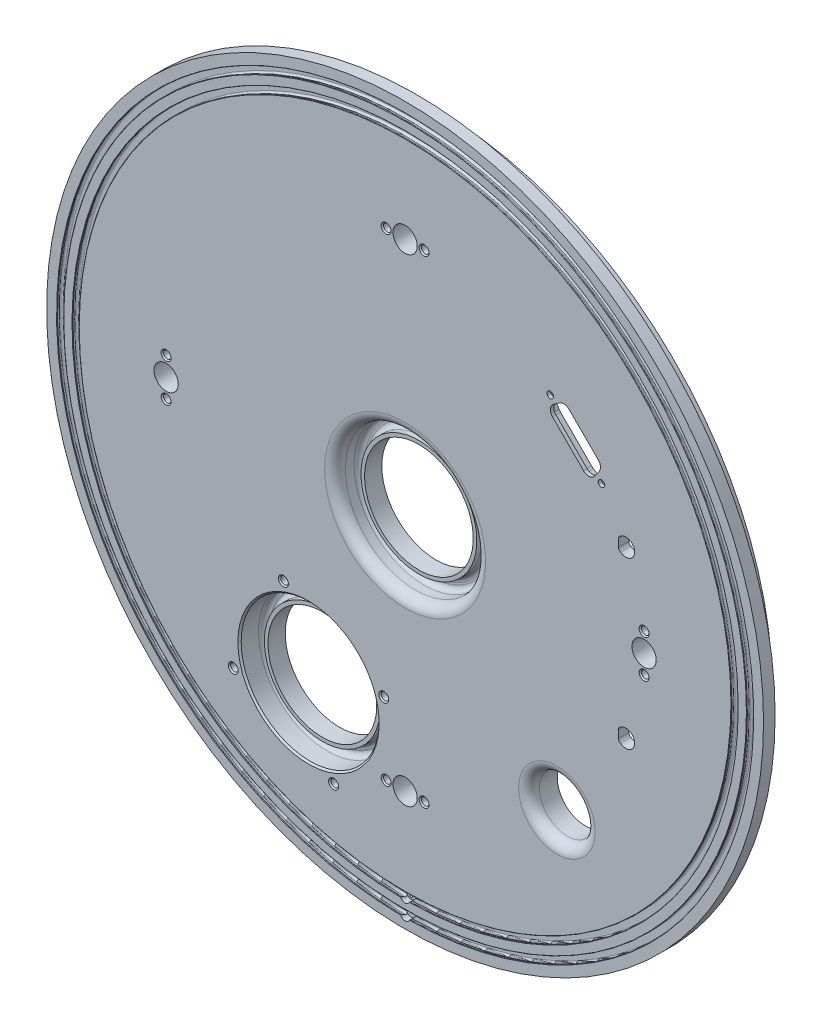
from build123d import *

# Parameters (mm, degrees)
BE_00_MATERIAL_BLANK_DEPTH         = 0.508
BE_00_MATERIAL_BLANK_DEPTH_BACK    = 15.875
SKETCH1_W                          = 330.2
SKETCH1_H                          = 330.2
SKETCH5_W                          = 76.2
SKETCH5_H                          = 307.1876
CUT_EXTRUDE6_REACH                 = 235.745
SKETCH51_R                         = 2.1844
CUT_EXTRUDE4_DEPTH                 = 9.525
CE_00_GROOVE_FOR_GASKET_DEPTH      = 2.286
SKETCH20_R                         = 5.588
CE_00_STANDOFF_POCKET_DEPTH        = 11.43
F_8_32_TAPPED_HOLE3_AT_2_COUNT     = 2
F_8_32_TAPPED_HOLE3_AT_2_PITCH     = 17.4752
CIRPATTERN5_COUNT                  = 4
CIRPATTERN6_COUNT                  = 4
F_8_32_TAPPED_HOLE5_D              = 3.4544
F_8_32_TAPPED_HOLE5_DEPTH          = 11.1252
F_8_32_TAPPED_HOLE5_CSINK_D        = 4.572
F_8_32_TAPPED_HOLE5_CSINK_ANGLE    = 90
F_8_32_TAPPED_HOLE5_TIP            = 1.037806461
CUT_EXTRUDE3_CONNECTOR_HOLES_REACH = 235.501
F_10_32_TAPPED_HOLE3_D             = 4.0386
F_10_32_TAPPED_HOLE3_DEPTH         = 12.0396
F_10_32_TAPPED_HOLE3_CSINK_D       = 5.08
F_10_32_TAPPED_HOLE3_CSINK_ANGLE   = 90
F_10_32_TAPPED_HOLE3_TIP           = 1.213317848
F_55_0_052_DIAMETER_HOLE1_D        = 1.3208
F_55_0_052_DIAMETER_HOLE1_DEPTH    = 7.9502
F_55_0_052_DIAMETER_HOLE1_TIP      = 0.396808353
SKETCH63_W                         = 6.35
SKETCH63_H                         = 34.751317012
F_41_0_096_DIAMETER_HOLE1_D        = 2.4384
F_41_0_096_DIAMETER_HOLE1_DEPTH    = 19.05
F_41_0_096_DIAMETER_HOLE1_TIP      = 0.732569267
F_10_32_TAPPED_HOLE4_D             = 4.0386
F_10_32_TAPPED_HOLE4_DEPTH         = 8.7376
F_10_32_TAPPED_HOLE4_CSINK_D       = 5.3086
F_10_32_TAPPED_HOLE4_CSINK_ANGLE   = 90
F_10_32_TAPPED_HOLE4_TIP           = 1.213317848
FILLET1_R                          = 2.3876
CIRPATTERN8_COUNT                  = 4
CHAMFER1_SIZE                      = 0.762
FILLET2_R                          = 1.6002
FILLET5_R                          = 4.7752
SKETCH52_R                         = 1.4986
CUT_EXTRUDE7_DEPTH                 = 234.501407171
CUT_EXTRUDE8_DEPTH                 = 3.175


with BuildPart() as part:
    # Sketch1 → BE-00 Material Blank (new, two sides: drawn at the far end of the back side and taken through both)
    with BuildSketch(Plane.XY.offset(-BE_00_MATERIAL_BLANK_DEPTH_BACK)):
        Rectangle(SKETCH1_W, SKETCH1_H)
    extrude(amount=BE_00_MATERIAL_BLANK_DEPTH + BE_00_MATERIAL_BLANK_DEPTH_BACK)

    # Sketch5 → CR-00 Profile Turn All (revolve, cut)
    with BuildSketch(Plane(origin=(0, 0, 0), x_dir=(0, 0, -1), z_dir=(1, 0, 0)), mode=Mode.PRIVATE) as cr_00_profile_turn_all_sk:
        with Locations((11.364913282, 153.5938)):
            Rectangle(SKETCH5_W, SKETCH5_H)
        with BuildLine():
            Line((0, 164.973), (0, 23.8125))
            Line((0, 23.8125), (14.3002, 23.8125))
            Line((14.3002, 23.8125), (14.3002, 154.7876))
            Line((14.3002, 154.7876), (8.9662, 154.7876))
            ThreePointArc((8.9662, 154.7876), (7.834687729, 155.256287729), (7.366, 156.3878))
            Line((7.366, 156.3878), (7.366, 157.389472759))
            Line((7.366, 157.389472759), (5.334, 164.973))
            Line((5.334, 164.973), (0, 164.973))
        make_face(mode=Mode.SUBTRACT)
    revolve(cr_00_profile_turn_all_sk.sketch.rotate(Axis((0, 0, -60.195390771), (0, 0, -1)), 90), axis=Axis((0, 0, -60.195390771), (0, 0, -1)), mode=Mode.SUBTRACT)

    # Sketch18 → CR-00 O-ring Grooves Radome (revolve, cut)
    with BuildSketch(Plane(origin=(0, 0, 0), x_dir=(0, 0, -1), z_dir=(1, 0, 0)), mode=Mode.PRIVATE) as cr_00_o_ring_grooves_radome_sk:
        with BuildLine():
            Line((-0.0254, 171.45), (-0.0254, 160.528))
            ThreePointArc((-0.0254, 160.528), (0.090261685, 160.314977676), (0.331911107, 160.295959454))
            Line((0.331911107, 160.295959454), (1.737135567, 160.921605693))
            ThreePointArc((1.737135567, 160.921605693), (2.486248776, 160.862649204), (2.8448, 160.202279999))
            Line((2.8448, 160.202279999), (2.8448, 157.297720001))
            ThreePointArc((2.8448, 157.297720001), (2.486248776, 156.637350796), (1.737135567, 156.578394307))
            Line((1.737135567, 156.578394307), (0.331911107, 157.204040546))
            ThreePointArc((0.331911107, 157.204040546), (0.090261685, 157.185022324), (-0.0254, 156.972))
            Line((-0.0254, 156.972), (-0.0254, 153.416))
            ThreePointArc((-0.0254, 153.416), (0.090261685, 153.202977676), (0.331911107, 153.183959454))
            Line((0.331911107, 153.183959454), (1.737135567, 153.809605693))
            ThreePointArc((1.737135567, 153.809605693), (2.486248776, 153.750649204), (2.8448, 153.090279999))
            Line((2.8448, 153.090279999), (2.8448, 150.185720001))
            ThreePointArc((2.8448, 150.185720001), (2.486248776, 149.525350796), (1.737135567, 149.466394307))
            Line((1.737135567, 149.466394307), (0.331911107, 150.092040546))
            ThreePointArc((0.331911107, 150.092040546), (0.090261685, 150.073022324), (-0.0254, 149.86))
            Line((-0.0254, 149.86), (-0.0254, 138.938))
            Line((-0.0254, 138.938), (-19.014781745, 119.948618255))
            Line((-19.014781745, 119.948618255), (-19.014781745, 171.45))
            Line((-19.014781745, 171.45), (-0.0254, 171.45))
        make_face()
    revolve(cr_00_o_ring_grooves_radome_sk.sketch.rotate(Axis((0, 0, 87.110448783), (0, 0, -1)), 90), axis=Axis((0, 0, 87.110448783), (0, 0, -1)), mode=Mode.SUBTRACT)

    # Cut-Extrude6: up to this face of the body (flat: up to its plane)
    cut_extrude6_end = Plane(part.part.faces().sort_by_distance((-152.657275299, 0, -2.8448))[0])
    # Sketch51 → Cut-Extrude6 (cut, up to the picked face)
    with BuildSketch(Plane.XY, mode=Mode.PRIVATE) as cut_extrude6_sk1:
        with Locations((0, -152.4)):
            Circle(SKETCH51_R)
    cut_extrude6_tool1 = split(extrude(cut_extrude6_sk1.sketch, amount=-CUT_EXTRUDE6_REACH, mode=Mode.PRIVATE), bisect_by=cut_extrude6_end, keep=Keep.BOTH, mode=Mode.PRIVATE)
    # Sketch51 → Cut-Extrude6 (cut, up to the picked face)
    with BuildSketch(Plane.XY, mode=Mode.PRIVATE) as cut_extrude6_sk2:
        with Locations((0, -159.512)):
            Circle(SKETCH51_R)
    cut_extrude6_tool2 = split(extrude(cut_extrude6_sk2.sketch, amount=-CUT_EXTRUDE6_REACH, mode=Mode.PRIVATE), bisect_by=cut_extrude6_end, keep=Keep.BOTH, mode=Mode.PRIVATE)
    add(cut_extrude6_tool1.solids().sort_by(Axis((0, -152.4, 0), (0, 0, -1)))[0], mode=Mode.SUBTRACT)
    add(cut_extrude6_tool2.solids().sort_by(Axis((0, -159.512, 0), (0, 0, -1)))[0], mode=Mode.SUBTRACT)

    # Sketch29 → Cut-Extrude4 (cut)
    with BuildSketch(Plane(origin=(0, 0, -14.3002), x_dir=(-1, 0, 0), z_dir=(0, 0, -1))):
        with BuildLine():
            Line((13.748153285, 109.5375), (16.039284443, 113.505855572))
            ThreePointArc((16.039284443, 113.505855572), (29.495327916, 118.403454867), (36.655139101, 106.002298122))
            Line((36.655139101, 106.002298122), (26.185554718, 46.626334551))
            ThreePointArc((26.185554718, 46.626334551), (22.638268275, 41.645855636), (16.535863775, 41.259758957))
            ThreePointArc((16.535863775, 41.259758957), (0, 44.45), (-16.535863775, 41.259758957))
            ThreePointArc((-16.535863775, 41.259758957), (-22.638268275, 41.645855636), (-26.185554718, 46.626334551))
            Line((-26.185554718, 46.626334551), (-36.655139101, 106.002298122))
            ThreePointArc((-36.655139101, 106.002298122), (-29.495327916, 118.403454867), (-16.039284443, 113.505855572))
            Line((-16.039284443, 113.505855572), (-13.748153285, 109.5375))
            ThreePointArc((-13.748153285, 109.5375), (0, 101.6), (13.748153285, 109.5375))
        make_face()
        with BuildLine():
            Line((-122.2502, -22.225), (-122.2502, -50.626559318))
            ThreePointArc((-122.2502, -50.626559318), (-120.855409426, -54.856696476), (-117.218124528, -57.42762232))
            ThreePointArc((-117.218124528, -57.42762232), (-112.953452637, -61.812780623), (-114.369422175, -67.763584766))
            ThreePointArc((-114.369422175, -67.763584766), (-116.191126438, -72.008147551), (-115.021344629, -76.476539898))
            ThreePointArc((-115.021344629, -76.476539898), (-112.289204697, -80.434478823), (-109.420931162, -84.29490316))
            ThreePointArc((-109.420931162, -84.29490316), (-101.752921651, -86.769544222), (-96.695607569, -80.496921763))
            ThreePointArc((-96.695607569, -80.496921763), (-88.128655597, -62.781526979), (-69.797615218, -55.626050961))
            ThreePointArc((-69.797615218, -55.626050961), (-66.50596015, -54.825677206), (-63.95796839, -52.593340038))
            Line((-63.95796839, -52.593340038), (-41.637407585, -20.716275615))
            ThreePointArc((-41.637407585, -20.716275615), (-41.154795878, -13.353043863), (-47.463216924, -9.525))
            Line((-47.463216924, -9.525), (-99.78529618, -9.525))
            ThreePointArc((-99.78529618, -9.525), (-101.02028202, -9.633047261), (-102.217743439, -9.953906081))
            Line((-102.217743439, -9.953906081), (-117.570647259, -15.541906081))
            ThreePointArc((-117.570647259, -15.541906081), (-120.964009339, -18.145724385), (-122.2502, -22.225))
        make_face()
        with BuildLine():
            Line((-11.487435309, -104.057554296), (10.636701717, -68.096953606))
            ThreePointArc((10.636701717, -68.096953606), (18.61883726, -58.752746202), (29.076216994, -52.297367907))
            ThreePointArc((29.076216994, -52.297367907), (33.002032679, -41.747934438), (22.226379645, -38.494032627))
            ThreePointArc((22.226379645, -38.494032627), (-0.240063406, -44.449351734), (-22.64087039, -38.251712223))
            ThreePointArc((-22.64087039, -38.251712223), (-27.765081492, -37.420329852), (-32.089218991, -40.292710564))
            Line((-32.089218991, -40.292710564), (-46.522506687, -60.905581617))
            ThreePointArc((-46.522506687, -60.905581617), (-47.80451385, -64.74095445), (-46.78843223, -68.655185572))
            ThreePointArc((-46.78843223, -68.655185572), (-43.333019149, -87.213850616), (-52.913434869, -103.479752449))
            ThreePointArc((-52.913434869, -103.479752449), (-55.539784163, -108.598138475), (-53.520396113, -113.98494254))
            ThreePointArc((-53.520396113, -113.98494254), (-51.235426875, -117.803021705), (-50.934051114, -122.242389405))
            ThreePointArc((-50.934051114, -122.242389405), (-50.05670486, -127.029663369), (-46.306438838, -130.131797026))
            ThreePointArc((-46.306438838, -130.131797026), (-31.259715574, -134.541447358), (-15.81017563, -137.217379444))
            ThreePointArc((-15.81017563, -137.217379444), (-9.413735188, -134.558658051), (-8.313023385, -127.719675428))
            Line((-8.313023385, -127.719675428), (-12.674010254, -115.737962481))
            ThreePointArc((-12.674010254, -115.737962481), (-13.418339941, -109.761874181), (-11.487435309, -104.057554296))
        make_face()
        with BuildLine():
            Line((102.217743439, 9.953906081), (117.570647259, 15.541906081))
            ThreePointArc((117.570647259, 15.541906081), (120.964009339, 18.145724385), (122.2502, 22.225))
            Line((122.2502, 22.225), (122.2502, 49.2252))
            ThreePointArc((122.2502, 49.2252), (121.766835031, 51.655239796), (120.390328061, 53.715328061))
            Line((120.390328061, 53.715328061), (67.473921735, 106.631734386))
            ThreePointArc((67.473921735, 106.631734386), (60.306358661, 108.385625912), (55.441025567, 102.837776798))
            Line((55.441025567, 102.837776798), (40.459264184, 17.87198584))
            ThreePointArc((40.459264184, 17.87198584), (42.015108844, 12.06549452), (47.463216924, 9.525))
            Line((47.463216924, 9.525), (99.78529618, 9.525))
            ThreePointArc((99.78529618, 9.525), (101.02028202, 9.633047261), (102.217743439, 9.953906081))
        make_face()
        with BuildLine():
            Line((122.2502, -22.225), (122.2502, -62.511226792))
            ThreePointArc((122.2502, -62.511226792), (122.031392043, -64.26178312), (121.388431873, -65.904624136))
            ThreePointArc((121.388431873, -65.904624136), (114.325846816, -77.512396589), (106.156947565, -88.370093123))
            ThreePointArc((106.156947565, -88.370093123), (97.143099774, -92.36792449), (88.493378325, -87.633536832))
            Line((88.493378325, -87.633536832), (41.637407585, -20.716275615))
            ThreePointArc((41.637407585, -20.716275615), (41.154795878, -13.353043863), (47.463216924, -9.525))
            Line((47.463216924, -9.525), (99.78529618, -9.525))
            ThreePointArc((99.78529618, -9.525), (101.02028202, -9.633047261), (102.217743439, -9.953906081))
            Line((102.217743439, -9.953906081), (117.570647259, -15.541906081))
            ThreePointArc((117.570647259, -15.541906081), (120.964009339, -18.145724385), (122.2502, -22.225))
        make_face()
        with BuildLine():
            Line((-120.390328061, 53.715328061), (-67.473921735, 106.631734386))
            ThreePointArc((-67.473921735, 106.631734386), (-60.306358661, 108.385625912), (-55.441025567, 102.837776798))
            Line((-55.441025567, 102.837776798), (-40.459264184, 17.87198584))
            ThreePointArc((-40.459264184, 17.87198584), (-42.015108844, 12.06549452), (-47.463216924, 9.525))
            Line((-47.463216924, 9.525), (-99.78529618, 9.525))
            ThreePointArc((-99.78529618, 9.525), (-101.02028202, 9.633047261), (-102.217743439, 9.953906081))
            Line((-102.217743439, 9.953906081), (-117.570647259, 15.541906081))
            ThreePointArc((-117.570647259, 15.541906081), (-120.964009339, 18.145724385), (-122.2502, 22.225))
            Line((-122.2502, 22.225), (-122.2502, 49.2252))
            ThreePointArc((-122.2502, 49.2252), (-121.766835031, 51.655239796), (-120.390328061, 53.715328061))
        make_face()
    extrude(amount=-CUT_EXTRUDE4_DEPTH, mode=Mode.SUBTRACT)

    # Sketch34 → CE-00 Groove for Gasket (cut)
    with BuildSketch(Plane(origin=(0, 0, -14.3002), x_dir=(-1, 0, 0), z_dir=(0, 0, -1))):
        with BuildLine():
            Line((-55.064487758, 131.7752), (55.064487758, 131.7752))
            ThreePointArc((55.064487758, 131.7752), (59.924567349, 130.808470063), (64.044743879, 128.055456121))
            Line((64.044743879, 128.055456121), (131.230456121, 60.869743879))
            ThreePointArc((131.230456121, 60.869743879), (133.983470063, 56.749567349), (134.9502, 51.889487758))
            Line((134.9502, 51.889487758), (134.9502, -64.291986087))
            ThreePointArc((134.9502, -64.291986087), (134.579892294, -67.33643808), (133.490564104, -70.20334928))
            ThreePointArc((133.490564104, -70.20334928), (0, -150.8252), (-133.490564104, -70.20334928))
            ThreePointArc((-133.490564104, -70.20334928), (-134.579892294, -67.33643808), (-134.9502, -64.291986087))
            Line((-134.9502, -64.291986087), (-134.9502, 51.889487758))
            ThreePointArc((-134.9502, 51.889487758), (-133.983470063, 56.749567349), (-131.230456121, 60.869743879))
            Line((-131.230456121, 60.869743879), (-64.044743879, 128.055456121))
            ThreePointArc((-64.044743879, 128.055456121), (-59.924567349, 130.808470063), (-55.064487758, 131.7752))
        make_face()
        with BuildLine():
            Line((-55.064487758, 124.6632), (55.064487758, 124.6632))
            ThreePointArc((55.064487758, 124.6632), (57.202922778, 124.237838828), (59.015800451, 123.026512693))
            Line((59.015800451, 123.026512693), (126.201512693, 55.840800451))
            ThreePointArc((126.201512693, 55.840800451), (127.412838828, 54.027922778), (127.8382, 51.889487758))
            Line((127.8382, 51.889487758), (127.8382, -64.291986087))
            ThreePointArc((127.8382, -64.291986087), (127.675264609, -65.631544964), (127.195960206, -66.892985892))
            ThreePointArc((127.195960206, -66.892985892), (0, -143.7132), (-127.195960206, -66.892985892))
            ThreePointArc((-127.195960206, -66.892985892), (-127.675264609, -65.631544964), (-127.8382, -64.291986087))
            Line((-127.8382, -64.291986087), (-127.8382, 51.889487758))
            ThreePointArc((-127.8382, 51.889487758), (-127.412838828, 54.027922778), (-126.201512693, 55.840800451))
            Line((-126.201512693, 55.840800451), (-59.015800451, 123.026512693))
            ThreePointArc((-59.015800451, 123.026512693), (-57.202922778, 124.237838828), (-55.064487758, 124.6632))
        make_face(mode=Mode.SUBTRACT)
    extrude(amount=-CE_00_GROOVE_FOR_GASKET_DEPTH, mode=Mode.SUBTRACT)

    # Sketch23 → CR-00 Hole for Cooler (revolve, cut)
    with BuildSketch(Plane(origin=(0, 0, 0), x_dir=(0, 0, -1), z_dir=(1, 0, 0)), mode=Mode.PRIVATE) as cr_00_hole_for_cooler_sk:
        Polygon((44.68963757, 25.019), (6.35, 25.019), (6.35, 26.67), (11.1252, 26.67), (11.1252, 32.258), (-9.342963899, 32.258), (-9.342963899, 0), (44.68963757, 0), align=None)
    revolve(cr_00_hole_for_cooler_sk.sketch.rotate(Axis((0, 0, -44.68963757), (0, 0, 1)), 90), axis=Axis((0, 0, -44.68963757), (0, 0, 1)), mode=Mode.SUBTRACT)

    # Sketch20 → CE-00 Standoff Pocket (cut)
    with BuildSketch(Plane(origin=(0, 0, 0), x_dir=(-1, 0, 0), z_dir=(0, 0, -1))):
        with Locations((-109.982, 0)):
            Circle(SKETCH20_R)
    ce_00_standoff_pocket = extrude(amount=CE_00_STANDOFF_POCKET_DEPTH, mode=Mode.SUBTRACT)

    # Sketch21 → #8-32 Tapped Hole3 (revolve, cut)
    with BuildSketch(Plane(origin=(109.982, 8.7376, 0), x_dir=(0, -1, 0), z_dir=(1, 0, 0))):
        Polygon((0, 0), (0, 12.163006461), (1.7272, 11.1252), (1.7272, 0.5588), (2.286, 0), align=None)
    f_8_32_tapped_hole3 = revolve(axis=Axis((109.982, 8.7376, 6.35), (0, 0, -1)), mode=Mode.SUBTRACT)

    # #8-32 Tapped Hole3 at 2: #8-32 Tapped Hole3 ×2
    with Locations(*[(0, -i * F_8_32_TAPPED_HOLE3_AT_2_PITCH, 0) for i in range(1, F_8_32_TAPPED_HOLE3_AT_2_COUNT)]):
        add(f_8_32_tapped_hole3, mode=Mode.SUBTRACT)

    # CirPattern5: CE-00 Standoff Pocket ×4 about axis
    cirpattern5_axis = Axis((0, 0, 0), (0, 0, 1))
    for i in range(1, CIRPATTERN5_COUNT):
        add(ce_00_standoff_pocket.rotate(cirpattern5_axis, i * 360 / CIRPATTERN5_COUNT), mode=Mode.SUBTRACT)

    # CirPattern6: #8-32 Tapped Hole3 ×4 about axis
    cirpattern6_axis = Axis((0, 0, 0), (0, 0, 1))
    for i in range(1, CIRPATTERN6_COUNT):
        add(f_8_32_tapped_hole3.rotate(cirpattern6_axis, i * 360 / CIRPATTERN6_COUNT), mode=Mode.SUBTRACT)

    # CirPattern6 copy 1 sketch → CirPattern6 copy 1 (revolve, cut)
    with BuildSketch(Plane(origin=(8.7376, 109.982, 0), x_dir=(1, 0, 0), z_dir=(0, 1, 0))):
        Polygon((0, 0), (0, 12.163006461), (1.7272, 11.1252), (1.7272, 0.5588), (2.286, 0), align=None)
    revolve(axis=Axis((8.7376, 109.982, 6.35), (0, 0, -1)), mode=Mode.SUBTRACT)

    # CirPattern6 copy 2 sketch → CirPattern6 copy 2 (revolve, cut)
    with BuildSketch(Plane(origin=(-109.982, 8.7376, 0), x_dir=(0, 1, 0), z_dir=(-1, 0, 0))):
        Polygon((0, 0), (0, 12.163006461), (1.7272, 11.1252), (1.7272, 0.5588), (2.286, 0), align=None)
    revolve(axis=Axis((-109.982, 8.7376, 6.35), (0, 0, -1)), mode=Mode.SUBTRACT)

    # CirPattern6 copy 3 sketch → CirPattern6 copy 3 (revolve, cut)
    with BuildSketch(Plane(origin=(-8.7376, -109.982, 0), x_dir=(-1, 0, 0), z_dir=(0, -1, 0))):
        Polygon((0, 0), (0, 12.163006461), (1.7272, 11.1252), (1.7272, 0.5588), (2.286, 0), align=None)
    revolve(axis=Axis((-8.7376, -109.982, 6.35), (0, 0, -1)), mode=Mode.SUBTRACT)

    # Sketch24 → CR-00 Hole for Turbo (revolve, cut)
    with BuildSketch(Plane(origin=(-44.45, 0, 0), x_dir=(0, 0, -1), z_dir=(1, 0, 0)), mode=Mode.PRIVATE) as cr_00_hole_for_turbo_sk:
        Polygon((30.004152795, -63.881), (6.35, -63.881), (6.35, -62.23), (11.1252, -62.23), (11.1252, -57.15), (-16.015173557, -57.15), (-16.015173557, -88.9), (30.004152795, -88.9), align=None)
    revolve(cr_00_hole_for_turbo_sk.sketch.rotate(Axis((-44.45, -88.9, -30.004152795), (0, 0, -1)), 90), axis=Axis((-44.45, -88.9, -30.004152795), (0, 0, -1)), mode=Mode.SUBTRACT)

    # #8-32 Tapped Hole5
    with Locations(Plane.XY):
        with Locations((-9.81120108, -77.353733693), (-55.996266307, -54.26120108), (-79.08879892, -100.446266307), (-32.903733693, -123.53879892)):
            CounterSinkHole(F_8_32_TAPPED_HOLE5_D / 2, F_8_32_TAPPED_HOLE5_CSINK_D / 2, depth=F_8_32_TAPPED_HOLE5_DEPTH, counter_sink_angle=F_8_32_TAPPED_HOLE5_CSINK_ANGLE)
            with Locations((0, 0, -(F_8_32_TAPPED_HOLE5_DEPTH + F_8_32_TAPPED_HOLE5_TIP / 2))):  # 118° drill point
                Cone(0, F_8_32_TAPPED_HOLE5_D / 2, F_8_32_TAPPED_HOLE5_TIP, mode=Mode.SUBTRACT)

    # Sketch28 → Cut-Extrude3 Connector Holes (cut, up to next)
    with BuildSketch(Plane(origin=(0, 0, -4.7752), x_dir=(-1, 0, 0), z_dir=(0, 0, -1)), mode=Mode.PRIVATE) as cut_extrude3_connector_holes_sk1:
        with BuildLine():
            Line((-99.195939526, 34.854883177), (-98.68500614, 35.233394899))
            ThreePointArc((-98.68500614, 35.233394899), (-98.306757477, 35.682562953), (-98.171, 36.253871887))
            Line((-98.171, 36.253871887), (-98.171, 39.946128113))
            ThreePointArc((-98.171, 39.946128113), (-98.306757477, 40.517437047), (-98.68500614, 40.966605101))
            Line((-98.68500614, 40.966605101), (-99.195939526, 41.345116823))
            ThreePointArc((-99.195939526, 41.345116823), (-105.6386, 38.1), (-99.195939526, 34.854883177))
        make_face()
    cut_extrude3_connector_holes_tool1 = extrude(cut_extrude3_connector_holes_sk1.sketch, amount=-CUT_EXTRUDE3_CONNECTOR_HOLES_REACH, mode=Mode.PRIVATE) & part.part
    # Sketch28 → Cut-Extrude3 Connector Holes (cut, up to next)
    with BuildSketch(Plane(origin=(0, 0, -4.7752), x_dir=(-1, 0, 0), z_dir=(0, 0, -1)), mode=Mode.PRIVATE) as cut_extrude3_connector_holes_sk2:
        with BuildLine():
            Line((-98.171, -39.946128113), (-98.171, -36.253871887))
            ThreePointArc((-98.171, -36.253871887), (-98.306757477, -35.682562953), (-98.68500614, -35.233394899))
            Line((-98.68500614, -35.233394899), (-99.195939526, -34.854883177))
            ThreePointArc((-99.195939526, -34.854883177), (-105.6386, -38.1), (-99.195939526, -41.345116823))
            Line((-99.195939526, -41.345116823), (-98.68500614, -40.966605101))
            ThreePointArc((-98.68500614, -40.966605101), (-98.306757477, -40.517437047), (-98.171, -39.946128113))
        make_face()
    cut_extrude3_connector_holes_tool2 = extrude(cut_extrude3_connector_holes_sk2.sketch, amount=-CUT_EXTRUDE3_CONNECTOR_HOLES_REACH, mode=Mode.PRIVATE) & part.part
    add(cut_extrude3_connector_holes_tool1.solids().sort_by_distance((101.724691, 38.1, -4.7752))[0], mode=Mode.SUBTRACT)
    add(cut_extrude3_connector_holes_tool2.solids().sort_by_distance((101.724691, -38.1, -4.7752))[0], mode=Mode.SUBTRACT)

    # #10-32 Tapped Hole3
    with Locations(Plane(origin=(0, 0, -14.3002), x_dir=(-1, 0, 0), z_dir=(0, 0, -1))):
        with Locations((92.075, -98.425), (50.8, 115.9002), (-50.8, 115.9002), (-60.325, -120.65), (119.0752, 11.1252), (-119.0752, 11.1252), (-119.0752, -63.5), (19.05, -134.9502)):
            CounterSinkHole(F_10_32_TAPPED_HOLE3_D / 2, F_10_32_TAPPED_HOLE3_CSINK_D / 2, depth=F_10_32_TAPPED_HOLE3_DEPTH, counter_sink_angle=F_10_32_TAPPED_HOLE3_CSINK_ANGLE)
            with Locations((0, 0, -(F_10_32_TAPPED_HOLE3_DEPTH + F_10_32_TAPPED_HOLE3_TIP / 2))):  # 118° drill point
                Cone(0, F_10_32_TAPPED_HOLE3_D / 2, F_10_32_TAPPED_HOLE3_TIP, mode=Mode.SUBTRACT)

    # #55 (0.052) Diameter Hole1
    with Locations(Plane.XY):
        with Locations((0, -153.162)):
            Hole(F_55_0_052_DIAMETER_HOLE1_D / 2, depth=F_55_0_052_DIAMETER_HOLE1_DEPTH)
            with Locations((0, 0, -(F_55_0_052_DIAMETER_HOLE1_DEPTH + F_55_0_052_DIAMETER_HOLE1_TIP / 2))):  # 118° drill point
                Cone(0, F_55_0_052_DIAMETER_HOLE1_D / 2, F_55_0_052_DIAMETER_HOLE1_TIP, mode=Mode.SUBTRACT)

    # Sketch63 → Cut-Revolve2 (revolve, cut)
    with BuildSketch(Plane(origin=(0, 0, 0), x_dir=(0, 0, -1), z_dir=(1, 0, 0))):
        with Locations((9.271, -172.112458506)):
            Rectangle(SKETCH63_W, SKETCH63_H)
    revolve(axis=Axis((0, -189.488117012, -12.446), (0, -1, 0)), mode=Mode.SUBTRACT)

    # #41 (0.096) Diameter Hole1
    with Locations(Plane.XZ.offset(154.7368)):
        with Locations((0, -8.89)):
            Hole(F_41_0_096_DIAMETER_HOLE1_D / 2, depth=F_41_0_096_DIAMETER_HOLE1_DEPTH)
            with Locations((0, 0, -(F_41_0_096_DIAMETER_HOLE1_DEPTH + F_41_0_096_DIAMETER_HOLE1_TIP / 2))):  # 118° drill point
                Cone(0, F_41_0_096_DIAMETER_HOLE1_D / 2, F_41_0_096_DIAMETER_HOLE1_TIP, mode=Mode.SUBTRACT)

    # #10-32 Tapped Hole4
    with Locations(Plane(origin=(0, 0, -14.3002), x_dir=(-1, 0, 0), z_dir=(0, 0, -1))):
        with Locations((0, -134.9502)):
            CounterSinkHole(F_10_32_TAPPED_HOLE4_D / 2, F_10_32_TAPPED_HOLE4_CSINK_D / 2, depth=F_10_32_TAPPED_HOLE4_DEPTH, counter_sink_angle=F_10_32_TAPPED_HOLE4_CSINK_ANGLE)
            with Locations((0, 0, -(F_10_32_TAPPED_HOLE4_DEPTH + F_10_32_TAPPED_HOLE4_TIP / 2))):  # 118° drill point
                Cone(0, F_10_32_TAPPED_HOLE4_D / 2, F_10_32_TAPPED_HOLE4_TIP, mode=Mode.SUBTRACT)

    # Sketch46 → Cut-Revolve1 (revolve, cut)
    with BuildSketch(Plane(origin=(69.85, 0, 0), x_dir=(0, 0, -1), z_dir=(1, 0, 0)), mode=Mode.PRIVATE) as cut_revolve1_sk:
        Polygon((-25.4, -82.55), (25.4, -82.55), (25.4, -66.04), (12.740715605, -66.04), (13.6652, -68.58), (13.0302, -68.58), (13.0302, -69.723), (-6.35, -69.723), (-6.35, -68.072), (-3.175, -68.072), (-3.175, -62.992), (-25.4, -62.992), align=None)
    revolve(cut_revolve1_sk.sketch.rotate(Axis((69.85, -82.55, -25.4), (0, 0, -1)), 90), axis=Axis((69.85, -82.55, -25.4), (0, 0, -1)), mode=Mode.SUBTRACT)

    # Fillet1
    fillet1_edges = [part.edges().sort_by_distance(p)[0] for p in [
        (26.67, 0, -11.1252),
        (32.258, 0, -11.1252),
        (-76.2, -88.9, -11.1252),
        (-71.12, -88.9, -11.1252),
    ]]
    fillet(fillet1_edges, radius=FILLET1_R)

    # Sketch48 → 1/4-28 Tapped Hole1 (revolve, cut)
    with BuildSketch(Plane(origin=(55.257083803, -67.957083803, -14.3002), x_dir=(0, 1, 0), z_dir=(1, 0, 0))):
        Polygon((0, 0), (0, 12.750588061), (2.7051, 11.1252), (2.7051, 0.6731), (3.3782, 0), align=None)
    f_1_4_28_tapped_hole1 = revolve(axis=Axis((55.257083803, -67.957083803, -20.6502), (0, 0, 1)), mode=Mode.SUBTRACT)

    # CirPattern8: 1/4-28 Tapped Hole1 ×4 about axis
    cirpattern8_axis = Axis((69.85, -82.55, 0), (0, 0, 1))
    for i in range(1, CIRPATTERN8_COUNT):
        add(f_1_4_28_tapped_hole1.rotate(cirpattern8_axis, i * 360 / CIRPATTERN8_COUNT), mode=Mode.SUBTRACT)

    # Chamfer1
    chamfer1_edges = [part.edges().sort_by_distance(p)[0] for p in [
        (-76.2, -88.9, 0),
    ]]
    chamfer(chamfer1_edges, length=CHAMFER1_SIZE)

    # Fillet2
    fillet2_edges = [part.edges().sort_by_distance(p)[0] for p in [
        (112.953452637, -61.812780623, -4.7752),
        (120.855409426, -54.856696476, -4.7752),
        (122.2502, -36.425779659, -4.7752),
        (120.964009339, -18.145724385, -4.7752),
        (109.894195349, -12.747906081, -4.7752),
        (101.02028202, -9.633047261, -4.7752),
        (73.624256552, -9.525, -4.7752),
        (41.154795878, -13.353043863, -4.7752),
        (52.797687987, -36.654807827, -4.7752),
        (66.50596015, -54.825677206, -4.7752),
        (88.128655597, -62.781526979, -4.7752),
        (101.752921651, -86.769544222, -4.7752),
        (112.289204697, -80.434478823, -4.7752),
        (116.191126438, -72.008147551, -4.7752),
        (-120.964009339, 18.145724385, -4.7752),
        (-109.894195349, 12.747906081, -4.7752),
        (-101.02028202, 9.633047261, -4.7752),
        (-73.624256552, 9.525, -4.7752),
        (-42.015108844, 12.06549452, -4.7752),
        (-47.950144876, 60.354881319, -4.7752),
        (-60.306358661, 108.385625912, -4.7752),
        (-93.932124898, 80.173531223, -4.7752),
        (-121.766835031, 51.655239796, -4.7752),
        (-122.2502, 35.7251, -4.7752),
        (121.766835031, 51.655239796, -4.7752),
        (93.932124898, 80.173531223, -4.7752),
        (60.306358661, 108.385625912, -4.7752),
        (47.950144876, 60.354881319, -4.7752),
        (42.015108844, 12.06549452, -4.7752),
        (73.624256552, 9.525, -4.7752),
        (101.02028202, 9.633047261, -4.7752),
        (109.894195349, 12.747906081, -4.7752),
        (120.964009339, 18.145724385, -4.7752),
        (122.2502, 35.7251, -4.7752),
        (-120.964009339, -18.145724385, -4.7752),
        (-122.2502, -42.368113396, -4.7752),
        (-122.031392043, -64.26178312, -4.7752),
        (-114.325846816, -77.512396589, -4.7752),
        (-97.143099774, -92.36792449, -4.7752),
        (-65.065392955, -54.174906224, -4.7752),
        (-41.154795878, -13.353043863, -4.7752),
        (-73.624256552, -9.525, -4.7752),
        (-101.02028202, -9.633047261, -4.7752),
        (-109.894195349, -12.747906081, -4.7752),
        (22.638268275, 41.645855636, -4.7752),
        (31.42034691, 76.314316336, -4.7752),
        (29.495327916, 118.403454867, -4.7752),
        (14.893718864, 111.521677786, -4.7752),
        (0, 101.6, -4.7752),
        (-14.893718864, 111.521677786, -4.7752),
        (-29.495327916, 118.403454867, -4.7752),
        (-31.42034691, 76.314316336, -4.7752),
        (-22.638268275, 41.645855636, -4.7752),
        (0, 44.45, -4.7752),
        (9.413735188, -134.558658051, -4.7752),
        (31.259715574, -134.541447358, -4.7752),
        (50.05670486, -127.029663369, -4.7752),
        (51.235426875, -117.803021705, -4.7752),
        (55.539784163, -108.598138475, -4.7752),
        (43.333019149, -87.213850616, -4.7752),
        (47.80451385, -64.74095445, -4.7752),
        (39.305862839, -50.59914609, -4.7752),
        (27.765081492, -37.420329852, -4.7752),
        (0.240063406, -44.449351734, -4.7752),
        (-33.002032679, -41.747934438, -4.7752),
        (-18.61883726, -58.752746202, -4.7752),
        (0.425366796, -86.077253951, -4.7752),
        (13.418339941, -109.761874181, -4.7752),
        (10.493516819, -121.728818955, -4.7752),
    ]]
    fillet(fillet2_edges, radius=FILLET2_R)

    # Fillet5
    fillet5_edges = [part.edges().sort_by_distance(p)[0] for p in [
        (32.258, 0, 0),
        (57.023, -82.55, 0),
    ]]
    fillet(fillet5_edges, radius=FILLET5_R)

    # Sketch52 → Cut-Extrude7 (cut, through all)
    with BuildSketch(Plane(origin=(0, 0, -4.7752), x_dir=(-1, 0, 0), z_dir=(0, 0, -1))):
        with Locations((-66.786164772, 81.388061225)):
            Circle(SKETCH52_R)
        with Locations(Location((-90.368317346, 57.805908651, 0), (0, 0, 180))):
            Circle(SKETCH52_R)
        with BuildLine():
            Line((-82.106481715, 58.847618361), (-67.827874482, 73.126225594))
            ThreePointArc((-67.827874482, 73.126225594), (-66.836592015, 75.849751788), (-68.285750035, 78.359767106))
            Line((-68.285750035, 78.359767106), (-71.074571473, 80.3125209))
            ThreePointArc((-71.074571473, 80.3125209), (-73.340222115, 80.91960016), (-75.466034226, 79.928317693))
            Line((-75.466034226, 79.928317693), (-88.908573814, 66.485778105))
            ThreePointArc((-88.908573814, 66.485778105), (-89.899856281, 64.359965994), (-89.292777021, 62.094315352))
            Line((-89.292777021, 62.094315352), (-87.340023227, 59.305493914))
            ThreePointArc((-87.340023227, 59.305493914), (-84.83000791, 57.856335894), (-82.106481715, 58.847618361))
        make_face()
    extrude(amount=-CUT_EXTRUDE7_DEPTH, mode=Mode.SUBTRACT)

    # Sketch53 → Cut-Extrude8 (cut)
    with BuildSketch(Plane(origin=(0, 0, -4.7752), x_dir=(-1, 0, 0), z_dir=(0, 0, -1))):
        with BuildLine():
            Line((-76.525704448, 80.987987915), (-89.968244036, 67.545448327))
            ThreePointArc((-89.968244036, 67.545448327), (-90.31267051, 67.1630106), (-90.615328324, 66.746733699))
            Line((-90.615328324, 66.746733699), (-94.627516999, 60.574593957))
            ThreePointArc((-94.627516999, 60.574593957), (-93.992738618, 54.246418457), (-87.677070792, 53.497359942))
            Line((-87.677070792, 53.497359942), (-81.920641709, 57.092995266))
            ThreePointArc((-81.920641709, 57.092995266), (-81.463980423, 57.415642959), (-81.046811493, 57.787948139))
            Line((-81.046811493, 57.787948139), (-66.76820426, 72.066555372))
            ThreePointArc((-66.76820426, 72.066555372), (-66.39589908, 72.483724302), (-66.073251387, 72.940385588))
            Line((-66.073251387, 72.940385588), (-62.477616063, 78.69681467))
            ThreePointArc((-62.477616063, 78.69681467), (-63.226674578, 85.012482497), (-69.554850078, 85.647260878))
            Line((-69.554850078, 85.647260878), (-75.72698982, 81.635072203))
            ThreePointArc((-75.72698982, 81.635072203), (-76.143266721, 81.332414389), (-76.525704448, 80.987987915))
        make_face()
    extrude(amount=-CUT_EXTRUDE8_DEPTH, mode=Mode.SUBTRACT)


solid = part.part
